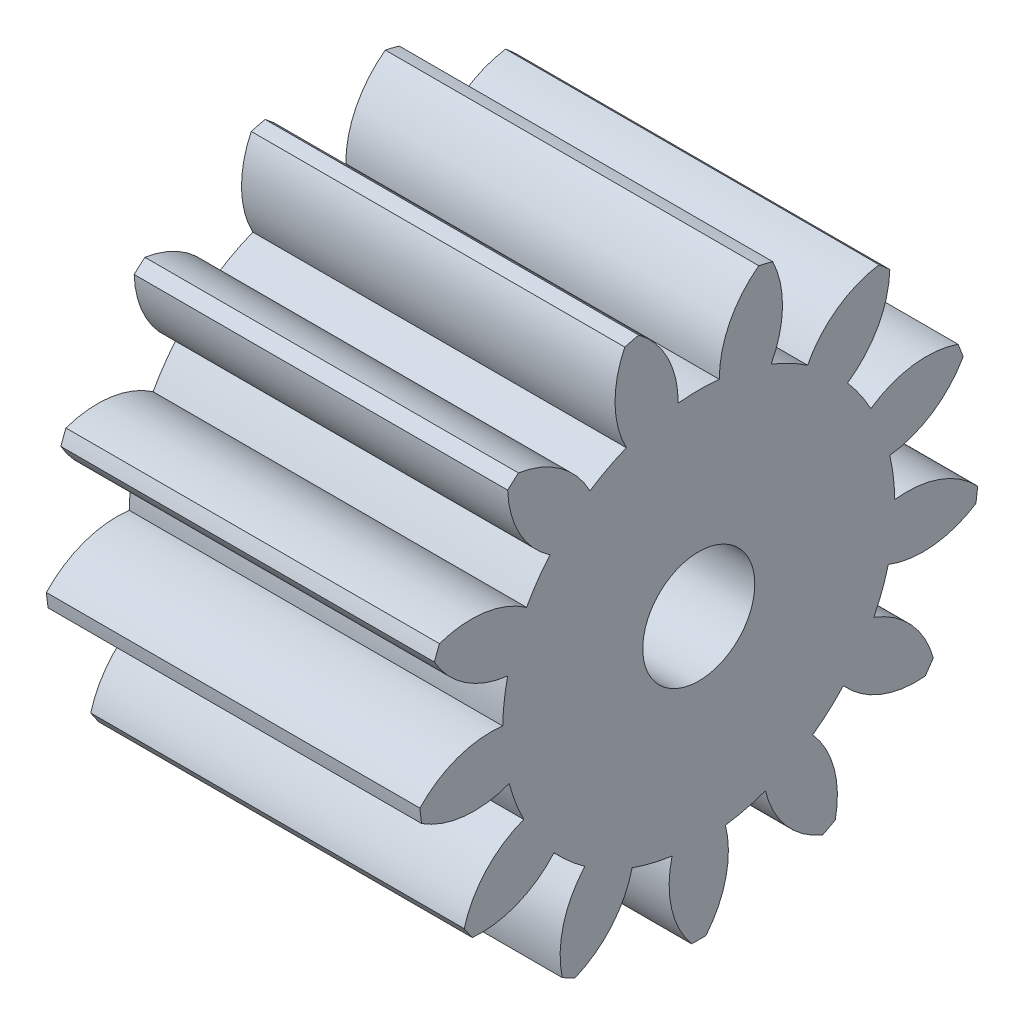
from build123d import *

# Parameters (mm, degrees)
SPUR_START             = -82.336241069
SPUR_GEAR_AM_OUTLINE_R = 0.75
SPUR_GEAR_AM_DEPTH     = 10
SKETCH1_R              = 1.5
CUT_EXTRUDE1_DEPTH     = 58.621788555


# Read off the part's stored shape, not the designer's step: spur gear_am
with BuildPart() as part:
    # spur gear_am outline → spur gear_am (new body)
    with BuildSketch(Plane.YZ.offset(SPUR_START)):
        with BuildLine():
            ThreePointArc((17.612350824, 50.763104468), (17.486787453, 50.908547943), (17.357539417, 51.050727089))
            ThreePointArc((17.357539417, 51.050727089), (16.188813726, 50.732061681), (15.291329502, 49.91843434))
            ThreePointArc((15.291329502, 49.91843434), (14.854728698, 50.254970318), (14.385241313, 50.54386186))
            ThreePointArc((14.385241313, 50.54386186), (14.8277438, 51.671540418), (14.711265291, 52.877318233))
            ThreePointArc((14.711265291, 52.877318233), (14.532493495, 52.947749826), (14.351976098, 53.01357865))
            ThreePointArc((14.351976098, 53.01357865), (13.465212093, 52.188280534), (13.048640757, 51.050767588))
            ThreePointArc((13.048640757, 51.050767588), (12.505653876, 51.145856886), (11.955688849, 51.183475976))
            ThreePointArc((11.955688849, 51.183475976), (11.823446986, 52.38762691), (11.159957498, 53.401159879))
            ThreePointArc((11.159957498, 53.401159879), (10.96893174, 53.380444561), (10.778499344, 53.354842474))
            ThreePointArc((10.778499344, 53.354842474), (10.37684397, 52.211977503), (10.536616995, 51.011169457))
            ThreePointArc((10.536616995, 51.011169457), (10.01163579, 50.843028264), (9.50718348, 50.620756821))
            ThreePointArc((9.50718348, 50.620756821), (8.830492284, 51.625523664), (7.771989262, 52.214623599))
            ThreePointArc((7.771989262, 52.214623599), (7.612471242, 52.107507), (7.455749612, 51.99633913))
            ThreePointArc((7.455749612, 51.99633913), (7.631217275, 50.797723895), (8.330732588, 49.808711403))
            ThreePointArc((8.330732588, 49.808711403), (7.944023925, 49.415858839), (7.600648277, 48.984616573))
            ThreePointArc((7.600648277, 48.984616573), (6.534529546, 49.559819349), (5.323503276, 49.589530554))
            ThreePointArc((5.323503276, 49.589530554), (5.23203665, 49.420551796), (5.144928824, 49.249285363))
            ThreePointArc((5.144928824, 49.249285363), (5.857321998, 48.26950817), (6.936329068, 47.718862074))
            ThreePointArc((6.936329068, 47.718862074), (6.776483242, 47.191295928), (6.672847479, 46.649875245))
            ThreePointArc((6.672847479, 46.649875245), (5.461536166, 46.66374193), (4.375418173, 46.127257926))
            ThreePointArc((4.375418173, 46.127257926), (4.372956842, 45.935128005), (4.375418173, 45.742998085))
            ThreePointArc((4.375418173, 45.742998085), (5.461536166, 45.206514081), (6.672847479, 45.220380767))
            ThreePointArc((6.672847479, 45.220380767), (6.776483242, 44.678960084), (6.936329068, 44.151393937))
            ThreePointArc((6.936329068, 44.151393937), (5.857321997, 43.600747842), (5.144928824, 42.620970649))
            ThreePointArc((5.144928824, 42.620970649), (5.23203665, 42.449704216), (5.323503276, 42.280725457))
            ThreePointArc((5.323503276, 42.280725457), (6.534529546, 42.310436662), (7.600648277, 42.885639438))
            ThreePointArc((7.600648277, 42.885639438), (7.944023925, 42.454397173), (8.330732588, 42.061544609))
            ThreePointArc((8.330732588, 42.061544609), (7.631217275, 41.072532117), (7.455749612, 39.873916882))
            ThreePointArc((7.455749612, 39.873916882), (7.612471242, 39.762749012), (7.771989262, 39.655632413))
            ThreePointArc((7.771989262, 39.655632413), (8.830492284, 40.244732348), (9.50718348, 41.24949919))
            ThreePointArc((9.50718348, 41.24949919), (10.01163579, 41.027227748), (10.536616995, 40.859086555))
            ThreePointArc((10.536616995, 40.859086555), (10.37684397, 39.658278509), (10.778499344, 38.515413538))
            ThreePointArc((10.778499344, 38.515413538), (10.96893174, 38.48981145), (11.159957498, 38.469096132))
            ThreePointArc((11.159957498, 38.469096132), (11.823446986, 39.482629102), (11.955688849, 40.686780036))
            ThreePointArc((11.955688849, 40.686780036), (12.505653876, 40.724399126), (13.048640757, 40.819488424))
            ThreePointArc((13.048640757, 40.819488424), (13.465212093, 39.681975477), (14.351976098, 38.856677361))
            ThreePointArc((14.351976098, 38.856677361), (14.532493494, 38.922506186), (14.711265291, 38.992937779))
            ThreePointArc((14.711265291, 38.992937779), (14.8277438, 40.198715594), (14.385241313, 41.326394152))
            ThreePointArc((14.385241313, 41.326394152), (14.854728697, 41.615285694), (15.291329502, 41.951821671))
            ThreePointArc((15.291329502, 41.951821671), (16.188813726, 41.138194331), (17.357539417, 40.819528923))
            ThreePointArc((17.357539417, 40.819528923), (17.486787453, 40.961708069), (17.612350824, 41.107151544))
            ThreePointArc((17.612350824, 41.107151544), (17.155134531, 42.228945038), (16.239259681, 43.021813653))
            ThreePointArc((16.239259681, 43.021813653), (16.520715521, 43.495796076), (16.750910267, 43.996682396))
            ThreePointArc((16.750910267, 43.996682396), (17.92370456, 43.69333288), (19.106650964, 43.954302584))
            ThreePointArc((19.106650964, 43.954302584), (19.155020473, 44.140260523), (19.198610363, 44.327396533))
            ThreePointArc((19.198610363, 44.327396533), (18.27244201, 45.108216336), (17.093010688, 45.384638363))
            ThreePointArc((17.093010688, 45.384638363), (17.121956842, 45.935128006), (17.093010688, 46.485617649))
            ThreePointArc((17.093010688, 46.485617649), (18.27244201, 46.762039676), (19.198610363, 47.542859479))
            ThreePointArc((19.198610363, 47.542859479), (19.155020473, 47.729995488), (19.106650964, 47.915953427))
            ThreePointArc((19.106650964, 47.915953427), (17.92370456, 48.176923132), (16.750910267, 47.873573616))
            ThreePointArc((16.750910267, 47.873573616), (16.520715521, 48.374459936), (16.239259681, 48.848442359))
            ThreePointArc((16.239259681, 48.848442359), (17.155134531, 49.641310974), (17.612350824, 50.763104468))
        make_face()
        with Locations((11.872956842, 45.935128006)):
            Circle(SPUR_GEAR_AM_OUTLINE_R, mode=Mode.SUBTRACT)
    extrude(amount=SPUR_GEAR_AM_DEPTH)

    # Sketch1 → Cut-Extrude1 (cut, through all)
    with BuildSketch(Plane(origin=(-72.336241069, 0, 0), x_dir=(0, 0, -1), z_dir=(1, 0, 0))):
        with Locations((-45.935128006, 11.872956842)):
            Circle(SKETCH1_R)
    extrude(amount=-CUT_EXTRUDE1_DEPTH, mode=Mode.SUBTRACT)


solid = part.part
